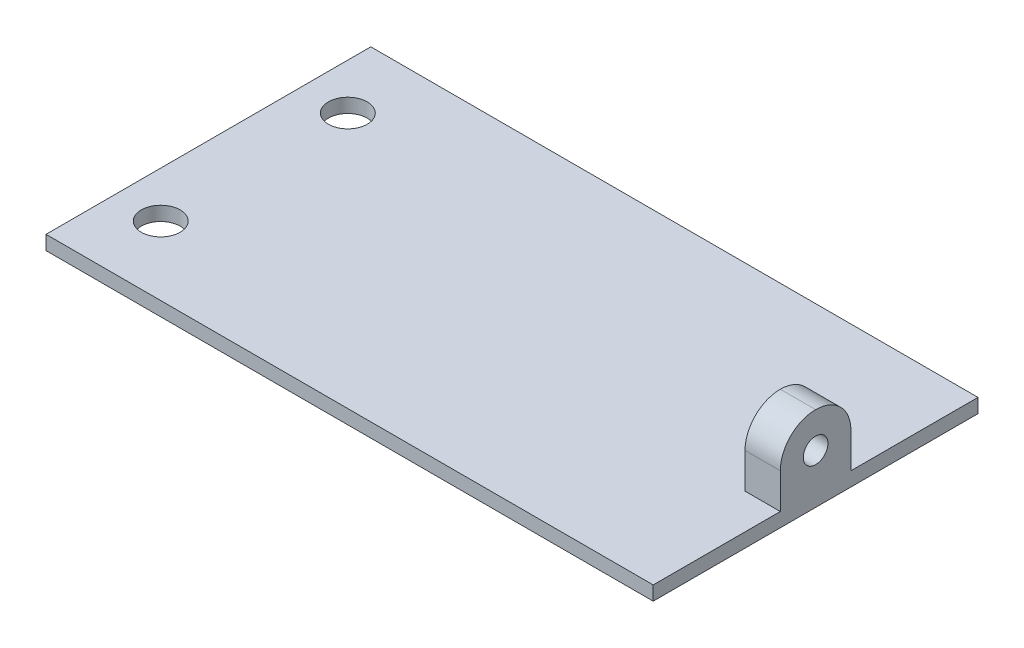
from build123d import *

# Parameters (mm, degrees)
SKETCH1_W           = 86
SKETCH1_H           = 46
BOSS_EXTRUDE1_DEPTH = 2
CUT_EXTRUDE1_REACH  = 50.806
SKETCH2_R           = 2.75
SKETCH3_W           = 5
SKETCH3_H           = 10
BOSS_EXTRUDE2_DEPTH = 10
SKETCH4_R           = 1.75
CUT_EXTRUDE2_DEPTH  = 10
FILLET1_R           = 5


with BuildPart() as part:
    # Sketch1 → Boss-Extrude1 (new body)
    with BuildSketch(Plane(origin=(0, 0, 0), x_dir=(1, 0, 0), z_dir=(0, 1, 0))):
        Rectangle(SKETCH1_W, SKETCH1_H)
    extrude(amount=BOSS_EXTRUDE1_DEPTH)

    # Sketch2 → Cut-Extrude1 (cut, up to next)
    with BuildSketch(Plane(origin=(0, 2, 0), x_dir=(1, 0, 0), z_dir=(0, 1, 0)), mode=Mode.PRIVATE) as cut_extrude1_sk1:
        with Locations(Location((-36.5, 13.25, 0), (0, 0, 270))):
            Circle(SKETCH2_R)
    cut_extrude1_tool1 = extrude(cut_extrude1_sk1.sketch, amount=-CUT_EXTRUDE1_REACH, mode=Mode.PRIVATE) & part.part
    # Sketch2 → Cut-Extrude1 (cut, up to next)
    with BuildSketch(Plane(origin=(0, 2, 0), x_dir=(1, 0, 0), z_dir=(0, 1, 0)), mode=Mode.PRIVATE) as cut_extrude1_sk2:
        with Locations(Location((-36.5, -13.25, 0), (0, 0, 270))):
            Circle(SKETCH2_R)
    cut_extrude1_tool2 = extrude(cut_extrude1_sk2.sketch, amount=-CUT_EXTRUDE1_REACH, mode=Mode.PRIVATE) & part.part
    add(cut_extrude1_tool1.solids().sort_by_distance((-36.5, 2, -13.25))[0], mode=Mode.SUBTRACT)
    add(cut_extrude1_tool2.solids().sort_by_distance((-36.5, 2, 13.25))[0], mode=Mode.SUBTRACT)

    # Sketch3 → Boss-Extrude2 (add)
    with BuildSketch(Plane(origin=(0, 2, 0), x_dir=(1, 0, 0), z_dir=(0, 1, 0))):
        with Locations((40.5, 0)):
            Rectangle(SKETCH3_W, SKETCH3_H)
    extrude(amount=BOSS_EXTRUDE2_DEPTH)

    # Sketch4 → Cut-Extrude2 (cut)
    with BuildSketch(Plane(origin=(43, 0, 0), x_dir=(0, 0, -1), z_dir=(1, 0, 0))):
        with Locations((0, 7)):
            Circle(SKETCH4_R)
    extrude(amount=-CUT_EXTRUDE2_DEPTH, mode=Mode.SUBTRACT)

    # Fillet1
    fillet1_edges = [part.edges().sort_by_distance(p)[0] for p in [
        (40.5, 12, -5),
        (40.5, 12, 5),
    ]]
    fillet(fillet1_edges, radius=FILLET1_R - 0.0001)  # a hair under: the kernel refuses the full size


solid = part.part
